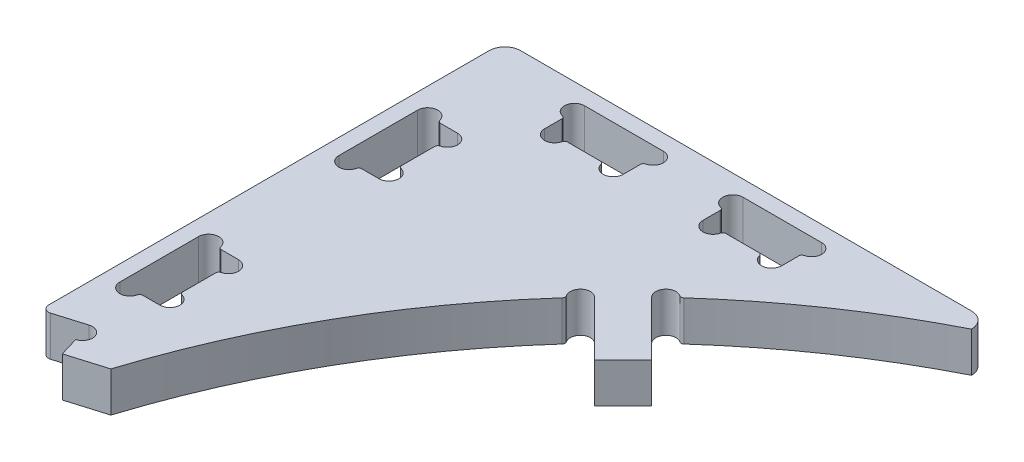
from build123d import *

# Parameters (mm, degrees)
SKETCH1_W           = 25
SKETCH1_H           = 12.7
SKETCH1_W_2         = 12.7
SKETCH1_H_2         = 25
BOSS_EXTRUDE1_DEPTH = 12.7
SKETCH2_R           = 3.2
CUT_EXTRUDE1_DEPTH  = 351.503213473
FILLET1_R           = 5
FILLET2_R           = 1
FILLET3_R           = 2


with BuildPart() as part:
    # Sketch1 → Boss-Extrude1 (new body)
    with BuildSketch(Plane(origin=(0, 0, 0), x_dir=(1, 0, 0), z_dir=(0, 1, 0))):
        with BuildLine():
            Line((-172.193276216, 181.244243015), (-154.927095758, 163.978062557))
            Line((-154.927095758, 163.978062557), (-163.978062557, 154.927095758))
            Line((-163.978062557, 154.927095758), (-181.244243015, 172.193276216))
            ThreePointArc((-181.244243015, 172.193276216), (-215.239427447, 127.169134904), (-238.273429132, 75.668837508))
            Line((-238.273429132, 75.668837508), (-250.116468804, 72.111522519))
            Line((-250.116468804, 72.111522519), (-253.769935453, 84.27467102))
            Line((-253.769935453, 84.27467102), (-265.736660352, 80.680204478))
            Line((-265.736660352, 80.680204478), (-265.736660352, 228.2))
            Line((-265.736660352, 228.2), (-112.613320704, 228.2))
            Line((-112.613320704, 228.2), (-112.613320704, 223.2))
            ThreePointArc((-112.613320704, 223.2), (-143.940163951, 204.40457236), (-172.193276216, 181.244243015))
        make_face()
        with Locations((-172.656660352, 216.85)):
            Rectangle(SKETCH1_W, SKETCH1_H, mode=Mode.SUBTRACT)
        with Locations((-222.946660352, 216.85)):
            Rectangle(SKETCH1_W, SKETCH1_H, mode=Mode.SUBTRACT)
        with Locations((-254.386660352, 183)):
            Rectangle(SKETCH1_W_2, SKETCH1_H_2, mode=Mode.SUBTRACT)
        with Locations((-254.386660352, 113.474827547)):
            Rectangle(SKETCH1_W_2, SKETCH1_H_2, mode=Mode.SUBTRACT)
    extrude(amount=BOSS_EXTRUDE1_DEPTH)

    # Sketch2 → Cut-Extrude1 (cut, through all)
    with BuildSketch(Plane(origin=(0, 12.7, 0), x_dir=(1, 0, 0), z_dir=(0, 1, 0))):
        with Locations((-169.859291345, 183.433424282)):
            Circle(SKETCH2_R)
        with Locations((-183.433424282, 169.859291345)):
            Circle(SKETCH2_R)
        with Locations((-181.956660352, 210.5)):
            Circle(SKETCH2_R)
        with Locations((-163.356660352, 210.5)):
            Circle(SKETCH2_R)
        with Locations((-160.156660352, 220)):
            Circle(SKETCH2_R)
        with Locations((-185.156660352, 220)):
            Circle(SKETCH2_R)
        with Locations((-210.446660352, 220)):
            Circle(SKETCH2_R)
        with Locations((-213.646660352, 210.5)):
            Circle(SKETCH2_R)
        with Locations((-232.246660352, 210.5)):
            Circle(SKETCH2_R)
        with Locations((-235.446660352, 220)):
            Circle(SKETCH2_R)
        with Locations((-257.536660352, 195.5)):
            Circle(SKETCH2_R)
        with Locations((-248.036660352, 192.3)):
            Circle(SKETCH2_R)
        with Locations((-248.036660352, 173.7)):
            Circle(SKETCH2_R)
        with Locations((-257.536660352, 170.5)):
            Circle(SKETCH2_R)
        with Locations((-257.536660352, 125.974827547)):
            Circle(SKETCH2_R)
        with Locations((-257.536660352, 100.974827547)):
            Circle(SKETCH2_R)
        with Locations((-248.036660352, 104.174827547)):
            Circle(SKETCH2_R)
        with Locations((-248.036660352, 122.774827547)):
            Circle(SKETCH2_R)
        with Locations((-252.849376927, 81.209940689)):
            Circle(SKETCH2_R)
    extrude(amount=-CUT_EXTRUDE1_DEPTH, mode=Mode.SUBTRACT)

    # Fillet1
    fillet1_edges = [part.edges().sort_by_distance(p)[0] for p in [
        (-112.613320704, 6.35, -228.2),
        (-265.736660352, 6.35, -228.2),
    ]]
    fillet(fillet1_edges, radius=FILLET1_R - 0.0001)  # a hair under: the kernel refuses the full size

    # Fillet2
    fillet2_edges = [part.edges().sort_by_distance(p)[0] for p in [
        (-167.497476727, 6.35, -185.592551817),
        (-185.592551817, 6.35, -167.497476727),
        (-248.036660352, 6.35, -107.374827547),
        (-254.336660352, 6.35, -100.974827547),
        (-254.336660352, 6.35, -125.974827547),
        (-248.036660352, 6.35, -119.574827547),
        (-216.846660352, 6.35, -210.5),
        (-229.046660352, 6.35, -210.5),
        (-235.446660352, 6.35, -216.8),
        (-160.156660352, 6.35, -216.8),
        (-166.556660352, 6.35, -210.5),
        (-178.756660352, 6.35, -210.5),
        (-185.156660352, 6.35, -216.8),
        (-210.446660352, 6.35, -216.8),
        (-248.036660352, 6.35, -189.1),
        (-248.036660352, 6.35, -176.9),
        (-254.336660352, 6.35, -170.5),
        (-254.336660352, 6.35, -195.5),
    ]]
    fillet(fillet2_edges, radius=FILLET2_R)

    # Fillet3
    fillet3_edges = [part.edges().sort_by_distance(p)[0] for p in [
        (-265.736660352, 6.35, -80.680204478),
    ]]
    fillet(fillet3_edges, radius=FILLET3_R)


solid = part.part
